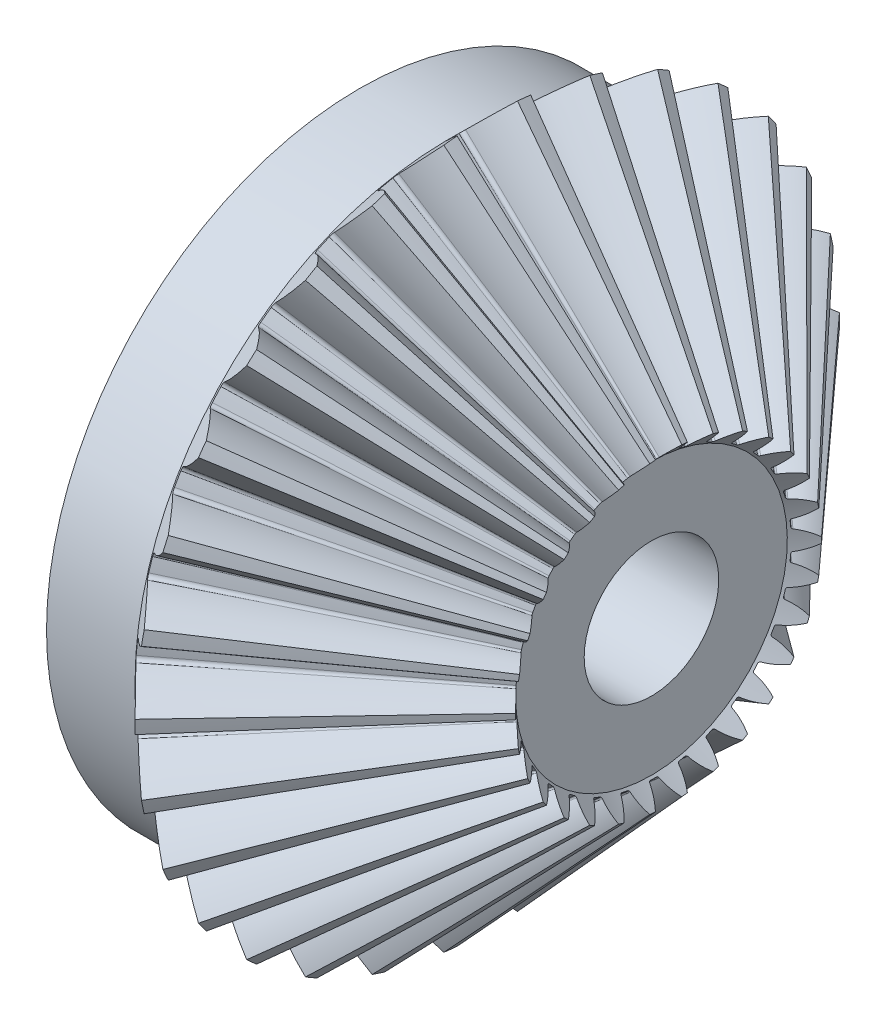
from build123d import *

# Parameters (mm, degrees)
TEETHCUTS_COUNT = 30
TEETHCUTS_ANGLE = 348
HUBSKE_R        = 13.949062546
HUB_DEPTH       = 3.949164146
BORSKE_R        = 3
BORE_DEPTH      = 20.0000508


with BuildPart() as part:
    # BasProSke → Base-Revolve (revolve)
    with BuildSketch(Plane(origin=(0, 0, 0), x_dir=(1, 0, 0), z_dir=(0, 1, 0)), mode=Mode.PRIVATE) as base_revolve_sk:
        Polygon((0, 0), (0, 13.949062547), (1.758044236, 15.707106781), (9.843325602, 6.821825399), (9.079781368, 6.058281166), (9.079781368, 0), align=None)
    revolve(base_revolve_sk.sketch.rotate(Axis((-10, 0, 0), (1, 0, 0)), 180), axis=Axis((-10, 0, 0), (1, 0, 0)))

    # ToothCut: read off the stored shape, not the designer's step
    # ToothCut: loft between two sections, ruled curve by curve
    toothcut_from = [
        Edge.make_bspline([(16.057310157, 0.006372702, -0.008948016), (16.052955033, 0.002017579, -0.015151394), (16.046805452, -0.004132002, -0.014267426), (16.04342198, -0.007515475, -0.006951667)], [0, 0, 0, 0, 1, 1, 1, 1], 3, [1, 0.752798, 0.752798, 1]),
        Edge.make_bspline([(16.04342198, -0.007515475, 0.006951667), (16.046805452, -0.004132002, 0.014267426), (16.052955033, 0.002017579, 0.015151394), (16.057310157, 0.006372702, 0.008948016)], [0, 0, 0, 0, 1, 1, 1, 1], 3, [1, 0.752798, 0.752798, 1]),
        Edge.make_bspline([(16.04342198, -0.007515475, -0.006951667), (16.042991938, -0.007945517, -0.00602183), (16.042651363, -0.008286091, -0.005020587), (16.042406078, -0.008531377, -0.003965059)], [0, 0, 0, 0, 1, 1, 1, 1], 3, [1, 0.994300589, 0.994300589, 1]),
        Edge.make_bspline([(16.042406078, -0.008531377, 0.003965059), (16.042651363, -0.008286091, 0.005020587), (16.042991938, -0.007945517, 0.00602183), (16.04342198, -0.007515475, 0.006951667)], [0, 0, 0, 0, 1, 1, 1, 1], 3, [1, 0.994300589, 0.994300589, 1]),
        Edge.make_bspline([(16.042406078, -0.008531377, -0.003965059), (16.041802396, -0.009135059, -0.001367249), (16.041802396, -0.009135059, 0.001367249), (16.042406078, -0.008531377, 0.003965059)], [0, 0, 0, 0, 1, 1, 1, 1], 3, [1, 0.966675555, 0.966675555, 1]),
        Edge.make_line((16.057310157, 0.006372702, 0.008948016), (16.057310157, 0.006372702, -0.008948016)),
    ]
    toothcut_to = [
        Edge.make_bspline([(1.93183305, 15.880895594, -1.554738237), (1.450416696, 15.39947924, -1.033713021), (0.902073449, 14.851135995, -0.668158569), (0.311519787, 14.260582334, -0.474552183)], [0, 0, 0, 0, 1, 1, 1, 1], 3, [1, 0.984975059, 0.984975059, 1]),
        Edge.make_bspline([(0.311519787, 14.260582334, 0.474552183), (0.902073449, 14.851135995, 0.668158569), (1.450416696, 15.39947924, 1.033713021), (1.93183305, 15.880895594, 1.554738237)], [0, 0, 0, 0, 1, 1, 1, 1], 3, [1, 0.984975059, 0.984975059, 1]),
        Edge.make_bspline([(0.311519787, 14.260582334, -0.474552183), (0.247234926, 14.196297473, -0.453477114), (0.206716831, 14.155779378, -0.379816993), (0.208085806, 14.157148353, -0.286513739)], [0, 0, 0, 0, 1, 1, 1, 1], 3, [1, 0.850928303, 0.850928303, 1]),
        Edge.make_bspline([(0.208085806, 14.157148353, 0.286513739), (0.206716831, 14.155779378, 0.379816993), (0.247234926, 14.196297473, 0.453477114), (0.311519787, 14.260582334, 0.474552183)], [0, 0, 0, 0, 1, 1, 1, 1], 3, [1, 0.850928303, 0.850928303, 1]),
        Edge.make_bspline([(0.208085806, 14.157148353, -0.286513739), (0.210888153, 14.1599507, -0.095518284), (0.210888153, 14.1599507, 0.095518284), (0.208085806, 14.157148353, 0.286513739)], [0, 0, 0, 0, 1, 1, 1, 1], 3, [1, 0.999856528, 0.999856528, 1]),
        Edge.make_line((1.93183305, 15.880895594, 1.554738237), (1.93183305, 15.880895594, -1.554738237)),
    ]
    toothcut = Solid(Shell([*[Face.make_surface_from_curves(toothcut_from[k], toothcut_to[k]) for k in range(6)], Face(Wire(toothcut_from)), Face(Wire(toothcut_to))]))
    add(toothcut, mode=Mode.SUBTRACT)

    # TeethCuts: ToothCut ×30 about axis
    teethcuts_axis = Axis((-10, 0, 0), (1, 0, 0))
    for i in range(1, TEETHCUTS_COUNT):
        add(toothcut.rotate(teethcuts_axis, i * TEETHCUTS_ANGLE / (TEETHCUTS_COUNT - 1)), mode=Mode.SUBTRACT)

    # HubSke → Hub (add)
    with BuildSketch(Plane.ZY):
        Circle(HUBSKE_R)
    extrude(amount=HUB_DEPTH)

    # BorSke → Bore (cut, symmetric)
    with BuildSketch(Plane(origin=(0, 0, 0), x_dir=(0, 0, -1), z_dir=(1, 0, 0))):
        with Locations(Location((0, 0, 0), (0, 0, 180))):
            Circle(BORSKE_R)
    extrude(amount=BORE_DEPTH, both=True, mode=Mode.SUBTRACT)


solid = part.part
